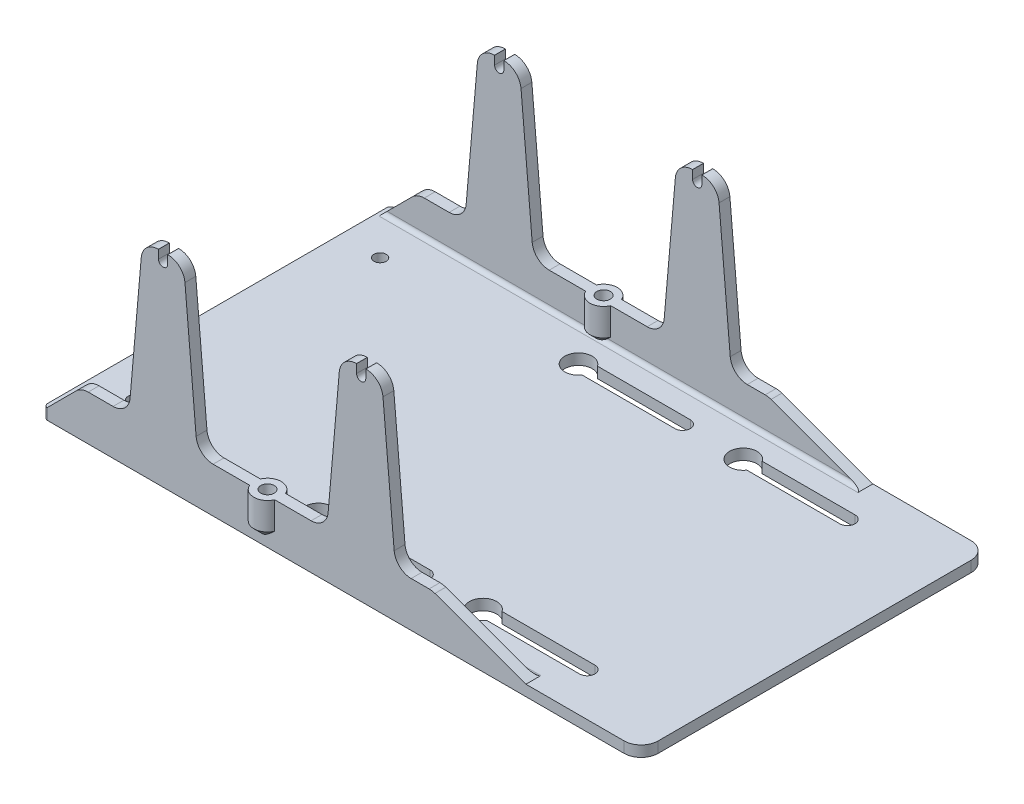
from build123d import *

# Parameters (mm, degrees)
SKETCH1_W                     = 175
SKETCH1_H                     = 101.6
PLATE_DEPTH                   = 3.175
BOTTOM_LABEL_DEPTH            = 0.6
MOUNT_SLOTS_DEPTH             = 3.175
SKETCH12_R                    = 4
SLOT_CLEARANCE_DEPTH          = 183.251805672
BRACKET_HOLES_D               = 3.6
PLATE_STIFFENER_DEPTH         = 3.175
RACK_EARS_DEPTH               = 3.175
LPATTERN1_COUNT               = 2
LPATTERN1_PITCH               = 58
STIFFENER_MIRROR_COPY_1_DEPTH = 3.175
FILLET3_R                     = 5
FILLET_1_2MM_R                = 1.2
FILLET2_R                     = 5


# Read off the part's stored shape, not the designer's step: mount slots
with BuildPart() as part:
    # Sketch1 → plate (new body)
    with BuildSketch(Plane(origin=(0, 0, 0), x_dir=(1, 0, 0), z_dir=(0, 1, 0))):
        with Locations((87.5, 0)):
            Rectangle(SKETCH1_W, SKETCH1_H)
    extrude(amount=PLATE_DEPTH)

    # Sketch14 → bottom label (cut)
    # profile 1 of 6: a face of its own
    with BuildSketch(Plane.XZ):
        with BuildLine():
            Line((77.403846154, 3.5), (78.086738782, 3.5))
            add(Edge.make_bspline(
                [(78.086738782, 3.5), (78.12016726, 3.49982425), (78.184959971, 3.499483602), (78.279179412, 3.49420047), (78.367428223, 3.486996801), (78.449731995, 3.475566708), (78.526052698, 3.461774931), (78.596620335, 3.445073115), (78.661210507, 3.425046501), (78.738323244, 3.39320022), (78.826243905, 3.345877051), (78.921442297, 3.275948486), (79.002846537, 3.190416023), (79.073032854, 3.093933368), (79.128833973, 2.987797596), (79.169203271, 2.874538407), (79.194761146, 2.755616665), (79.19738958, 2.673973487), (79.198717949, 2.63271234)],
                knots=[0, 0, 0, 0, 1.001505555, 1.941167018, 2.826882275, 3.653841531, 4.429895133, 5.150066043, 5.825578002, 6.45369114, 7.647487171, 8.808567382, 9.977351308, 11.170798116, 12.373658725, 13.556498008, 14.765093433, 16, 16, 16, 16], degree=3))
            add(Edge.make_bspline(
                [(79.198717949, 2.63271234), (79.19762473, 2.594059784), (79.195476453, 2.518103867), (79.174933694, 2.407009758), (79.142773025, 2.301258539), (79.098067776, 2.201236154), (79.03996578, 2.10920254), (78.971107461, 2.024415274), (78.888030659, 1.950464217), (78.825787419, 1.909121315), (78.794170673, 1.888120994)],
                knots=[0, 0, 0, 0, 1.044552857, 2.05264487, 3.044412934, 4.028983338, 5.005914585, 5.980388656, 6.974128949, 8, 8, 8, 8], degree=3))
            add(Edge.make_bspline(
                [(78.794170673, 1.888120994), (78.833931101, 1.872855995), (78.910002648, 1.84365027), (79.01468866, 1.792014806), (79.104883505, 1.735852696), (79.181280651, 1.674520846), (79.246618306, 1.608412035), (79.303671248, 1.536556921), (79.352352622, 1.458018163), (79.394065546, 1.373614627), (79.426614302, 1.284208159), (79.450990206, 1.190637383), (79.464957655, 1.093237828), (79.466945296, 1.026952448), (79.467948718, 0.993489583)],
                knots=[0, 0, 0, 0, 1.27268992, 2.434971085, 3.483601985, 4.442670788, 5.356604649, 6.2567628, 7.179492994, 8.113709626, 9.066344395, 10.018646069, 10.999752585, 12, 12, 12, 12], degree=3))
            add(Edge.make_bspline(
                [(79.467948718, 0.993489583), (79.466971872, 0.959322711), (79.4650499, 0.892098433), (79.450869928, 0.793343299), (79.426860821, 0.698968352), (79.393789675, 0.608363169), (79.35062736, 0.521703035), (79.298099396, 0.438889771), (79.235467832, 0.36075544), (79.165404963, 0.286431817), (79.086142818, 0.21960403), (79.000627063, 0.160088323), (78.907780743, 0.111142261), (78.809128749, 0.070026239), (78.703564433, 0.038619041), (78.591561826, 0.016646467), (78.473217524, 0.00184143), (78.392007773, 0.000624225), (78.350360577, 0)],
                knots=[0, 0, 0, 0, 0.978564426, 1.925352924, 2.850884081, 3.763762016, 4.682927383, 5.618979971, 6.567305752, 7.547517671, 8.540179244, 9.531824382, 10.526200242, 11.540722885, 12.589160233, 13.674978461, 14.80764778, 16, 16, 16, 16], degree=3))
            Line((78.350360577, 0), (77.403846154, 0))
            Line((77.403846154, 0), (77.403846154, 3.5))
        make_face()
        with BuildLine():
            Line((77.717948718, 3.141025641), (77.717948718, 2.019230769))
            Line((77.717948718, 2.019230769), (77.928986378, 2.019230769))
            add(Edge.make_bspline(
                [(77.928986378, 2.019230769), (77.959835174, 2.019630692), (78.019441333, 2.020403425), (78.105761229, 2.022616942), (78.185886248, 2.028814985), (78.259678081, 2.035011248), (78.327020525, 2.045085835), (78.387764386, 2.057077958), (78.442862983, 2.069760863), (78.506402529, 2.09133035), (78.578475477, 2.123208025), (78.655308581, 2.172679861), (78.723043051, 2.231604215), (78.780240239, 2.299595176), (78.827051709, 2.374461362), (78.859565424, 2.455008243), (78.881612708, 2.539228375), (78.88360424, 2.597046627), (78.884615385, 2.626402244)],
                knots=[0, 0, 0, 0, 1.156816544, 2.235205308, 3.236616184, 4.169592532, 5.011045266, 5.787822928, 6.49130361, 7.128639758, 8.301311294, 9.436451833, 10.541879658, 11.654887649, 12.756523258, 13.837046038, 14.901820046, 16, 16, 16, 16], degree=3))
            add(Edge.make_bspline(
                [(78.884615385, 2.626402244), (78.884089204, 2.645828015), (78.883057045, 2.683933787), (78.874603742, 2.739483141), (78.860236168, 2.791726894), (78.841781874, 2.841381004), (78.815993186, 2.886892854), (78.785629722, 2.92983605), (78.748944032, 2.968748169), (78.707186719, 3.005117667), (78.659178096, 3.037362195), (78.604946805, 3.065602958), (78.543759128, 3.088343735), (78.476646273, 3.108259887), (78.402575185, 3.122248181), (78.322400632, 3.133901569), (78.235465913, 3.139834311), (78.17532081, 3.140619673), (78.144230769, 3.141025641)],
                knots=[0, 0, 0, 0, 0.91205012, 1.789085906, 2.630437955, 3.453916878, 4.269457761, 5.079663411, 5.91843418, 6.774407191, 7.675494373, 8.627863946, 9.638891023, 10.736472738, 11.911756761, 13.175263542, 14.539845004, 16, 16, 16, 16], degree=3))
            Line((78.144230769, 3.141025641), (77.717948718, 3.141025641))
        make_face(mode=Mode.SUBTRACT)
        with BuildLine():
            Line((77.717948718, 1.66025641), (77.717948718, 0.358974359))
            Line((77.717948718, 0.358974359), (78.165264423, 0.358974359))
            add(Edge.make_bspline(
                [(78.165264423, 0.358974359), (78.197283349, 0.359358106), (78.258995608, 0.360097729), (78.348096838, 0.362512283), (78.430679941, 0.368004559), (78.506368077, 0.376650409), (78.57597853, 0.386028858), (78.638676233, 0.398640139), (78.694969426, 0.413089099), (78.760243734, 0.435423272), (78.833747242, 0.470119743), (78.912958099, 0.522433969), (78.983384317, 0.584757277), (79.043189576, 0.656888191), (79.092202565, 0.735319518), (79.12785802, 0.818464868), (79.149848876, 0.904950395), (79.152511046, 0.963917108), (79.153846154, 0.993489583)],
                knots=[0, 0, 0, 0, 1.160039823, 2.235823828, 3.228722157, 4.157150951, 4.99529583, 5.772374946, 6.472645482, 7.099169577, 8.269452708, 9.405989375, 10.527446681, 11.663510218, 12.788923519, 13.866172445, 14.929861265, 16, 16, 16, 16], degree=3))
            add(Edge.make_bspline(
                [(79.153846154, 0.993489583), (79.15357005, 1.011982924), (79.153022294, 1.048671306), (79.144761679, 1.102587125), (79.13274781, 1.154812998), (79.117216376, 1.205490739), (79.094596909, 1.253704115), (79.068190364, 1.300406674), (79.037228962, 1.345660154), (78.988984796, 1.402872407), (78.918812812, 1.46878942), (78.819106036, 1.533326923), (78.705733738, 1.58537473), (78.623506245, 1.607474206), (78.581029647, 1.618890224)],
                knots=[0, 0, 0, 0, 0.723448775, 1.435228256, 2.130040452, 2.821711965, 3.505591119, 4.210454504, 4.921174351, 5.648778258, 7.137944449, 8.670945889, 10.280296675, 12, 12, 12, 12], degree=3))
            add(Edge.make_bspline(
                [(78.581029647, 1.618890224), (78.564000552, 1.622345308), (78.527077959, 1.629836643), (78.466870379, 1.637744346), (78.39813451, 1.644789406), (78.320711633, 1.650000564), (78.234503792, 1.655387107), (78.139326873, 1.657481929), (78.035569558, 1.659981189), (77.963577186, 1.660162323), (77.926181891, 1.66025641)],
                knots=[0, 0, 0, 0, 0.634451884, 1.375622551, 2.216452059, 3.157844607, 4.20941857, 5.370758133, 6.634282058, 8, 8, 8, 8], degree=3))
            Line((77.926181891, 1.66025641), (77.717948718, 1.66025641))
        make_face(mode=Mode.SUBTRACT)
    # profile 2 of 6: a face of its own
    with BuildSketch(Plane.XZ):
        with BuildLine():
            add(Edge.make_bspline(
                [(82.119871795, 3.58974359), (82.184679901, 3.58810211), (82.311968368, 3.584878109), (82.499043265, 3.560199006), (82.677638361, 3.517503616), (82.8492085, 3.460640633), (83.011701476, 3.384786248), (83.166340369, 3.2931011), (83.312757242, 3.184624641), (83.448978624, 3.060195414), (83.573635574, 2.92481196), (83.683461461, 2.78033405), (83.775503754, 2.627635248), (83.851089541, 2.467174417), (83.910388151, 2.299314449), (83.951307195, 2.123160446), (83.977445345, 1.939853756), (83.980501122, 1.814826892), (83.982051282, 1.751402244)],
                knots=[0, 0, 0, 0, 1.065120563, 2.091984664, 3.0946048, 4.079830382, 5.057816894, 6.036188127, 7.030412546, 8.04752943, 9.064399622, 10.05169764, 11.02544977, 11.989514704, 12.962713494, 13.945757189, 14.957906945, 16, 16, 16, 16], degree=3))
            add(Edge.make_bspline(
                [(83.982051282, 1.751402244), (83.98050135, 1.688444797), (83.977446253, 1.564348377), (83.951277475, 1.382204933), (83.910236475, 1.207114236), (83.851640209, 1.039368583), (83.776414731, 0.87879102), (83.68375956, 0.725804066), (83.574618349, 0.580357567), (83.450411498, 0.444044902), (83.315010456, 0.319047431), (83.169780189, 0.210128556), (83.017986869, 0.116404431), (82.857677161, 0.041620757), (82.690977124, -0.018151163), (82.516394801, -0.058903793), (82.334748247, -0.085190837), (82.210877243, -0.088209353), (82.147916667, -0.08974359)],
                knots=[0, 0, 0, 0, 1.043624062, 2.057103931, 3.04512605, 4.022047818, 4.998200453, 5.980619268, 6.982898556, 8.009068085, 9.034988726, 10.034168286, 11.015286542, 11.987931943, 12.962482838, 13.94673481, 14.956375938, 16, 16, 16, 16], degree=3))
            add(Edge.make_bspline(
                [(82.147916667, -0.08974359), (82.084492348, -0.088194203), (81.959466132, -0.085139949), (81.775929096, -0.058958544), (81.599651353, -0.01801724), (81.431137001, 0.040492196), (81.270292072, 0.116109427), (81.116801989, 0.208313806), (80.971282842, 0.317720947), (80.834941095, 0.441887521), (80.710191897, 0.577059073), (80.601432521, 0.721893329), (80.509207408, 0.873548785), (80.433844076, 1.032446309), (80.374179616, 1.197817752), (80.333474798, 1.370766229), (80.307138846, 1.550305735), (80.304104, 1.672548634), (80.302564103, 1.734575321)],
                knots=[0, 0, 0, 0, 1.053102029, 2.075944431, 3.073151272, 4.055350789, 5.033113405, 6.020478099, 7.024410459, 8.052272461, 9.079885166, 10.07527673, 11.055994387, 12.023226415, 12.992069828, 13.970394897, 14.97016774, 16, 16, 16, 16], degree=3))
            add(Edge.make_bspline(
                [(80.302564103, 1.734575321), (80.303098738, 1.77620799), (80.304161264, 1.858948113), (80.316952957, 1.981814713), (80.335514658, 2.102705371), (80.362116571, 2.221276319), (80.396908238, 2.337237304), (80.437960265, 2.451388067), (80.48810011, 2.56257179), (80.544780758, 2.671315182), (80.608042566, 2.775923088), (80.677918316, 2.874802671), (80.751953684, 2.968783668), (80.833117078, 3.055430672), (80.918733523, 3.137264328), (81.010191901, 3.213027045), (81.106934146, 3.283401996), (81.209376525, 3.346822337), (81.3149948, 3.404181472), (81.423871578, 3.453403323), (81.53452815, 3.495649384), (81.647482798, 3.529890209), (81.76243557, 3.556922245), (81.879637354, 3.575329599), (81.99899478, 3.588153917), (82.079406099, 3.589211419), (82.119871795, 3.58974359)],
                knots=[0, 0, 0, 0, 1.037015668, 2.060948919, 3.074880161, 4.083647147, 5.086022904, 6.090072063, 7.104153813, 8.122640571, 9.144368836, 10.147691507, 11.138137339, 12.123020368, 13.103399296, 14.087645067, 15.080126199, 16.082011238, 17.087798457, 18.072939717, 19.057185487, 20.037253025, 21.01195951, 21.997135196, 22.992090687, 24, 24, 24, 24], degree=3))
        make_face()
        with BuildLine():
            add(Edge.make_bspline(
                [(82.135296474, 3.230769231), (82.102081841, 3.230364341), (82.035970108, 3.229558431), (81.937685572, 3.218942715), (81.840693638, 3.203812826), (81.744974276, 3.182231305), (81.650927986, 3.152827253), (81.557678145, 3.118986345), (81.466075091, 3.077765254), (81.376421233, 3.03119255), (81.289506158, 2.979643629), (81.207493457, 2.922671862), (81.130170813, 2.861613307), (81.057727546, 2.79632547), (80.990376374, 2.726475868), (80.926791673, 2.653123432), (80.869522091, 2.574171541), (80.817036514, 2.491761134), (80.770068674, 2.405999553), (80.728303319, 2.317789691), (80.69413931, 2.226412004), (80.666276934, 2.132857846), (80.643177123, 2.037275387), (80.628543199, 1.938939538), (80.61781084, 1.838344426), (80.617050994, 1.770362572), (80.616666667, 1.735977564)],
                knots=[0, 0, 0, 0, 1.008559885, 2.007477868, 2.99961109, 3.989939068, 4.984837346, 5.991145699, 7.001802488, 8.033829008, 9.059044045, 10.069351652, 11.065060232, 12.050310815, 13.029377138, 14.011219647, 14.996725999, 15.989392538, 16.977580475, 17.965360261, 18.951710183, 19.937753436, 20.929683414, 21.935841486, 22.955955122, 24, 24, 24, 24], degree=3))
            add(Edge.make_bspline(
                [(80.616666667, 1.735977564), (80.617941529, 1.685415343), (80.620449576, 1.585943813), (80.642407147, 1.440175669), (80.676229121, 1.300087383), (80.726086487, 1.166445474), (80.788437102, 1.038101191), (80.865463992, 0.916193086), (80.956723078, 0.800688212), (81.060386605, 0.692392943), (81.173709311, 0.593547138), (81.294042041, 0.50678373), (81.420095649, 0.43337348), (81.552198851, 0.373568408), (81.68964639, 0.32617867), (81.833323941, 0.293700039), (81.982274401, 0.272324583), (82.083805056, 0.270271827), (82.135296474, 0.269230769)],
                knots=[0, 0, 0, 0, 1.032063989, 2.030389145, 3.003944642, 3.970395727, 4.937377036, 5.913328081, 6.909231446, 7.93887556, 8.970685674, 9.976071282, 10.964166581, 11.944589148, 12.933237628, 13.927779006, 14.949070134, 16, 16, 16, 16], degree=3))
            add(Edge.make_bspline(
                [(82.135296474, 0.269230769), (82.169905976, 0.269706274), (82.238547012, 0.270649342), (82.340642535, 0.280148018), (82.440898746, 0.295379888), (82.539175026, 0.317310543), (82.635359838, 0.34475775), (82.729854641, 0.377365478), (82.821652931, 0.418046682), (82.911912769, 0.462994633), (82.998309011, 0.514234791), (83.080784543, 0.56927294), (83.157260523, 0.630241561), (83.229649594, 0.694559374), (83.297277283, 0.763523221), (83.359686267, 0.837043443), (83.4166664, 0.9155841), (83.469132046, 0.997869506), (83.515935309, 1.083865759), (83.556714408, 1.172395437), (83.591310524, 1.263240546), (83.619239029, 1.356532118), (83.64112449, 1.452092966), (83.65620441, 1.550051045), (83.666752849, 1.650210387), (83.667547926, 1.717954243), (83.667948718, 1.752103365)],
                knots=[0, 0, 0, 0, 1.047197238, 2.076906641, 3.100256066, 4.114471768, 5.12198147, 6.126382909, 7.136867548, 8.15857795, 9.17633901, 10.174870724, 11.156907918, 12.133735059, 13.104061851, 14.077631395, 15.04955518, 16.038496417, 17.029181396, 18.010275684, 18.986308667, 19.968651475, 20.955262928, 21.950658345, 22.966943676, 24, 24, 24, 24], degree=3))
            add(Edge.make_bspline(
                [(83.667948718, 1.752103365), (83.667547605, 1.78601887), (83.666751923, 1.85329652), (83.656209449, 1.952757338), (83.641108558, 2.05001055), (83.61934585, 2.144674353), (83.591295697, 2.236772878), (83.556708366, 2.326219625), (83.515923067, 2.413347821), (83.469114842, 2.497942118), (83.416499019, 2.579116855), (83.359004776, 2.656719268), (83.295639428, 2.729292009), (83.228213403, 2.798626703), (83.155042517, 2.863244593), (83.076458223, 2.923167114), (82.993414546, 2.979840388), (82.90548731, 3.03096595), (82.814743356, 3.078180182), (82.721629398, 3.118631186), (82.627200299, 3.153003305), (82.531696186, 3.18232027), (82.434313208, 3.2037283), (82.335709379, 3.21895635), (82.236021121, 3.229554736), (82.168977901, 3.230363114), (82.135296474, 3.230769231)],
                knots=[0, 0, 0, 0, 1.02996197, 2.043119294, 3.035359645, 4.018872909, 4.991431989, 5.957985074, 6.929999688, 7.912076566, 8.892894881, 9.867085534, 10.843653904, 11.817741046, 12.803660682, 13.806313499, 14.818574707, 15.856120519, 16.894564902, 17.924820532, 18.937903209, 19.946497019, 20.957711757, 21.963978472, 22.977135795, 24, 24, 24, 24], degree=3))
        make_face(mode=Mode.SUBTRACT)
    # profile 3 of 6: a face of its own
    with BuildSketch(Plane.XZ):
        Polygon((84.592307692, 3.141025641), (84.592307692, 3.5), (86.432051282, 3.5), (86.432051282, 3.141025641), (85.669230769, 3.141025641), (85.669230769, 0), (85.355128205, 0), (85.355128205, 3.141025641), align=None)
    # profile 4 of 6: a face of its own
    with BuildSketch(Plane.XZ):
        Polygon((86.862820513, 3.141025641), (86.862820513, 3.5), (88.702564103, 3.5), (88.702564103, 3.141025641), (87.93974359, 3.141025641), (87.93974359, 0), (87.625641026, 0), (87.625641026, 3.141025641), align=None)
    # profile 5 of 6: a face of its own
    with BuildSketch(Plane.XZ):
        with BuildLine():
            add(Edge.make_bspline(
                [(91.175, 3.58974359), (91.239808106, 3.58810211), (91.367096573, 3.584878109), (91.554171471, 3.560199006), (91.732766566, 3.517503616), (91.904336705, 3.460640633), (92.066829681, 3.384786248), (92.221468574, 3.2931011), (92.367885448, 3.184624641), (92.504106829, 3.060195414), (92.628763779, 2.92481196), (92.738589666, 2.78033405), (92.830631959, 2.627635248), (92.906217747, 2.467174417), (92.965516356, 2.299314449), (93.0064354, 2.123160446), (93.03257355, 1.939853756), (93.035629327, 1.814826892), (93.037179487, 1.751402244)],
                knots=[0, 0, 0, 0, 1.065120563, 2.091984664, 3.0946048, 4.079830382, 5.057816894, 6.036188127, 7.030412546, 8.04752943, 9.064399622, 10.05169764, 11.02544977, 11.989514704, 12.962713494, 13.945757189, 14.957906945, 16, 16, 16, 16], degree=3))
            add(Edge.make_bspline(
                [(93.037179487, 1.751402244), (93.035629555, 1.688444797), (93.032574458, 1.564348377), (93.006405681, 1.382204933), (92.965364681, 1.207114236), (92.906768414, 1.039368583), (92.831542936, 0.87879102), (92.738887765, 0.725804066), (92.629746554, 0.580357567), (92.505539703, 0.444044902), (92.370138661, 0.319047431), (92.224908394, 0.210128556), (92.073115074, 0.116404431), (91.912805366, 0.041620757), (91.746105329, -0.018151163), (91.571523006, -0.058903793), (91.389876452, -0.085190837), (91.266005448, -0.088209353), (91.203044872, -0.08974359)],
                knots=[0, 0, 0, 0, 1.043624062, 2.057103931, 3.04512605, 4.022047818, 4.998200453, 5.980619268, 6.982898556, 8.009068085, 9.034988726, 10.034168286, 11.015286542, 11.987931943, 12.962482838, 13.94673481, 14.956375938, 16, 16, 16, 16], degree=3))
            add(Edge.make_bspline(
                [(91.203044872, -0.08974359), (91.139620553, -0.088194203), (91.014594337, -0.085139949), (90.831057301, -0.058958544), (90.654779558, -0.01801724), (90.486265206, 0.040492196), (90.325420277, 0.116109427), (90.171930194, 0.208313806), (90.026411047, 0.317720947), (89.8900693, 0.441887521), (89.765320102, 0.577059073), (89.656560727, 0.721893329), (89.564335613, 0.873548785), (89.488972281, 1.032446309), (89.429307821, 1.197817752), (89.388603003, 1.370766229), (89.362267051, 1.550305735), (89.359232205, 1.672548634), (89.357692308, 1.734575321)],
                knots=[0, 0, 0, 0, 1.053102029, 2.075944431, 3.073151272, 4.055350789, 5.033113405, 6.020478099, 7.024410459, 8.052272461, 9.079885166, 10.07527673, 11.055994387, 12.023226415, 12.992069828, 13.970394897, 14.97016774, 16, 16, 16, 16], degree=3))
            add(Edge.make_bspline(
                [(89.357692308, 1.734575321), (89.358226943, 1.77620799), (89.35928947, 1.858948113), (89.372081162, 1.981814713), (89.390642863, 2.102705371), (89.417244776, 2.221276319), (89.452036443, 2.337237304), (89.49308847, 2.451388067), (89.543228316, 2.56257179), (89.599908964, 2.671315182), (89.663170772, 2.775923088), (89.733046521, 2.874802671), (89.807081889, 2.968783668), (89.888245283, 3.055430672), (89.973861728, 3.137264328), (90.065320106, 3.213027045), (90.162062351, 3.283401996), (90.264504731, 3.346822337), (90.370123005, 3.404181472), (90.478999783, 3.453403323), (90.589656355, 3.495649384), (90.702611003, 3.529890209), (90.817563775, 3.556922245), (90.934765559, 3.575329599), (91.054122986, 3.588153917), (91.134534305, 3.589211419), (91.175, 3.58974359)],
                knots=[0, 0, 0, 0, 1.037015668, 2.060948919, 3.074880161, 4.083647147, 5.086022904, 6.090072063, 7.104153813, 8.122640571, 9.144368836, 10.147691507, 11.138137339, 12.123020368, 13.103399296, 14.087645067, 15.080126199, 16.082011238, 17.087798457, 18.072939717, 19.057185487, 20.037253025, 21.01195951, 21.997135196, 22.992090687, 24, 24, 24, 24], degree=3))
        make_face()
        with BuildLine():
            add(Edge.make_bspline(
                [(91.190424679, 3.230769231), (91.157210046, 3.230364341), (91.091098313, 3.229558431), (90.992813777, 3.218942715), (90.895821843, 3.203812826), (90.800102481, 3.182231305), (90.706056191, 3.152827253), (90.61280635, 3.118986345), (90.521203296, 3.077765254), (90.431549438, 3.03119255), (90.344634363, 2.979643629), (90.262621662, 2.922671862), (90.185299018, 2.861613307), (90.112855751, 2.79632547), (90.045504579, 2.726475868), (89.981919878, 2.653123432), (89.924650296, 2.574171541), (89.872164719, 2.491761134), (89.825196879, 2.405999553), (89.783431524, 2.317789691), (89.749267515, 2.226412004), (89.721405139, 2.132857846), (89.698305328, 2.037275387), (89.683671404, 1.938939538), (89.672939045, 1.838344426), (89.672179199, 1.770362572), (89.671794872, 1.735977564)],
                knots=[0, 0, 0, 0, 1.008559885, 2.007477868, 2.99961109, 3.989939068, 4.984837346, 5.991145699, 7.001802488, 8.033829008, 9.059044045, 10.069351652, 11.065060232, 12.050310815, 13.029377138, 14.011219647, 14.996725999, 15.989392538, 16.977580475, 17.965360261, 18.951710183, 19.937753436, 20.929683414, 21.935841486, 22.955955122, 24, 24, 24, 24], degree=3))
            add(Edge.make_bspline(
                [(89.671794872, 1.735977564), (89.673069734, 1.685415343), (89.675577782, 1.585943813), (89.697535352, 1.440175669), (89.731357326, 1.300087383), (89.781214693, 1.166445474), (89.843565307, 1.038101191), (89.920592198, 0.916193086), (90.011851283, 0.800688212), (90.11551481, 0.692392943), (90.228837516, 0.593547138), (90.349170246, 0.50678373), (90.475223854, 0.43337348), (90.607327056, 0.373568408), (90.744774595, 0.32617867), (90.888452147, 0.293700039), (91.037402606, 0.272324583), (91.138933261, 0.270271827), (91.190424679, 0.269230769)],
                knots=[0, 0, 0, 0, 1.032063989, 2.030389145, 3.003944642, 3.970395727, 4.937377036, 5.913328081, 6.909231446, 7.93887556, 8.970685674, 9.976071282, 10.964166581, 11.944589148, 12.933237628, 13.927779006, 14.949070134, 16, 16, 16, 16], degree=3))
            add(Edge.make_bspline(
                [(91.190424679, 0.269230769), (91.225034181, 0.269706274), (91.293675217, 0.270649342), (91.39577074, 0.280148018), (91.496026952, 0.295379888), (91.594303231, 0.317310543), (91.690488043, 0.34475775), (91.784982846, 0.377365478), (91.876781136, 0.418046682), (91.967040974, 0.462994633), (92.053437216, 0.514234791), (92.135912748, 0.56927294), (92.212388728, 0.630241561), (92.284777799, 0.694559374), (92.352405488, 0.763523221), (92.414814473, 0.837043443), (92.471794605, 0.9155841), (92.524260251, 0.997869506), (92.571063514, 1.083865759), (92.611842613, 1.172395437), (92.646438729, 1.263240546), (92.674367234, 1.356532118), (92.696252695, 1.452092966), (92.711332615, 1.550051045), (92.721881054, 1.650210387), (92.722676131, 1.717954243), (92.723076923, 1.752103365)],
                knots=[0, 0, 0, 0, 1.047197238, 2.076906641, 3.100256066, 4.114471768, 5.12198147, 6.126382909, 7.136867548, 8.15857795, 9.17633901, 10.174870724, 11.156907918, 12.133735059, 13.104061851, 14.077631395, 15.04955518, 16.038496417, 17.029181396, 18.010275684, 18.986308667, 19.968651475, 20.955262928, 21.950658345, 22.966943676, 24, 24, 24, 24], degree=3))
            add(Edge.make_bspline(
                [(92.723076923, 1.752103365), (92.72267581, 1.78601887), (92.721880129, 1.85329652), (92.711337654, 1.952757338), (92.696236764, 2.05001055), (92.674474056, 2.144674353), (92.646423902, 2.236772878), (92.611836571, 2.326219625), (92.571051272, 2.413347821), (92.524243048, 2.497942118), (92.471627224, 2.579116855), (92.414132981, 2.656719268), (92.350767633, 2.729292009), (92.283341608, 2.798626703), (92.210170722, 2.863244593), (92.131586428, 2.923167114), (92.048542751, 2.979840388), (91.960615515, 3.03096595), (91.869871561, 3.078180182), (91.776757603, 3.118631186), (91.682328504, 3.153003305), (91.586824392, 3.18232027), (91.489441413, 3.2037283), (91.390837584, 3.21895635), (91.291149326, 3.229554736), (91.224106106, 3.230363114), (91.190424679, 3.230769231)],
                knots=[0, 0, 0, 0, 1.02996197, 2.043119294, 3.035359645, 4.018872909, 4.991431989, 5.957985074, 6.929999688, 7.912076566, 8.892894881, 9.867085534, 10.843653904, 11.817741046, 12.803660682, 13.806313499, 14.818574707, 15.856120519, 16.894564902, 17.924820532, 18.937903209, 19.946497019, 20.957711757, 21.963978472, 22.977135795, 24, 24, 24, 24], degree=3))
        make_face(mode=Mode.SUBTRACT)
    # profile 6 of 6: a face of its own
    with BuildSketch(Plane.XZ):
        Polygon((93.871794872, 0), (94.333834135, 3.5), (94.378705929, 3.5), (95.823717949, 0.628205128), (97.265224359, 3.5), (97.310797276, 3.5), (97.775641026, 0), (97.460136218, 0), (97.125, 2.518429487), (95.861578526, 0), (95.790765224, 0), (94.522435897, 2.524038462), (94.188000801, 0), align=None)
    extrude(amount=-BOTTOM_LABEL_DEPTH, mode=Mode.SUBTRACT)

    # mount slots outline → mount slots (cut)
    with BuildSketch(Plane(origin=(0, 0, 0), x_dir=(1, 0, 0), z_dir=(0, 1, 0))):
        with BuildLine():
            Line((67.75, -40.35), (98.25, -40.35))
            ThreePointArc((98.25, -40.35), (100.5, -38.1), (98.25, -35.85))
            Line((98.25, -35.85), (67.75, -35.85))
            ThreePointArc((67.75, -35.85), (65.5, -38.1), (67.75, -40.35))
        make_face()
        with BuildLine():
            ThreePointArc((146.51, -40.35), (148.76, -38.1), (146.51, -35.85))
            Line((146.51, -35.85), (116.01, -35.85))
            ThreePointArc((116.01, -35.85), (113.76, -38.1), (116.01, -40.35))
            Line((116.01, -40.35), (146.51, -40.35))
        make_face()
        with BuildLine():
            Line((116.01, 35.85), (146.51, 35.85))
            ThreePointArc((146.51, 35.85), (148.76, 38.1), (146.51, 40.35))
            Line((146.51, 40.35), (116.01, 40.35))
            ThreePointArc((116.01, 40.35), (113.76, 38.1), (116.01, 35.85))
        make_face()
        with BuildLine():
            ThreePointArc((98.25, 35.85), (100.5, 38.1), (98.25, 40.35))
            Line((98.25, 40.35), (67.75, 40.35))
            ThreePointArc((67.75, 40.35), (65.5, 38.1), (67.75, 35.85))
            Line((67.75, 35.85), (98.25, 35.85))
        make_face()
    extrude(amount=MOUNT_SLOTS_DEPTH, mode=Mode.SUBTRACT)

    # Sketch12 → slot_clearance (cut, through all)
    with BuildSketch(Plane(origin=(0, 3.175, 0), x_dir=(1, 0, 0), z_dir=(0, 1, 0))):
        with Locations((116.01, 38.1)):
            Circle(SKETCH12_R)
        with Locations((67.75, 38.1)):
            Circle(SKETCH12_R)
        with Locations((67.75, -38.1)):
            Circle(SKETCH12_R)
        with Locations((116.01, -38.1)):
            Circle(SKETCH12_R)
    extrude(amount=-SLOT_CLEARANCE_DEPTH, mode=Mode.SUBTRACT)

    # bracket holes (through all)
    with Locations(Plane(origin=(0, 3.175, 0), x_dir=(1, 0, 0), z_dir=(0, 1, 0))):
        with Locations((11.75, 36), (11.75, -36)):
            Hole(BRACKET_HOLES_D / 2)

    # Sketch13 → plate stiffener (add)
    with BuildSketch(Plane(origin=(0, 0, -50.8), x_dir=(-1, 0, 0), z_dir=(0, 0, -1))):
        Polygon((-141.26, 3.175), (-113.785225805, 13.175), (-11, 13.175), (-1, 3.175), align=None)
    plate_stiffener = extrude(amount=-PLATE_STIFFENER_DEPTH)

    # Sketch15 → rack ears (add)
    with BuildSketch(Plane(origin=(0, 0, -50.8), x_dir=(-1, 0, 0), z_dir=(0, 0, -1))):
        with BuildLine():
            Line((-45.068222854, 13.175), (-41, 59.675))
            Line((-41, 59.675), (-36.35, 59.675))
            Line((-36.35, 59.675), (-36.35, 57.175))
            ThreePointArc((-36.35, 57.175), (-35, 55.825), (-33.65, 57.175))
            Line((-33.65, 57.175), (-33.65, 59.675))
            Line((-33.65, 59.675), (-29, 59.675))
            Line((-29, 59.675), (-24.931777146, 13.175))
            Line((-24.931777146, 13.175), (-45.068222854, 13.175))
        make_face()
    rack_ears = extrude(amount=-RACK_EARS_DEPTH)

    # LPattern1: rack ears ×2
    with Locations(*[(i * LPATTERN1_PITCH, 0, 0) for i in range(1, LPATTERN1_COUNT)]):
        add(rack_ears)

    # Sketch21 → clamp boss (revolve)
    with BuildSketch(Plane(origin=(0, 0, -49.2125), x_dir=(-1, 0, 0), z_dir=(0, 0, -1))):
        Polygon((-64, 1.175), (-60, 5.175), (-60, 13.175), (-64, 13.175), align=None)
    clamp_boss = revolve(axis=Axis((64, 3.175, -49.2125), (0, 1, 0)))

    # Sketch19 → Tap Drill for M2.5 Tap1 (revolve, cut)
    with BuildSketch(Plane(origin=(64, 13.175, -49.2125), x_dir=(0, 0, 1), z_dir=(1, 0, 0))):
        Polygon((0, 0), (0, 9.063523296), (1.77, 8), (1.77, 2.860133251), (1.97, 0), align=None)
    tap_drill_for_m2_5_tap1 = revolve(axis=Axis((64, 19.525, -49.2125), (0, -1, 0)), mode=Mode.SUBTRACT)

    # stiffener mirror: plate stiffener, rack ears, clamp boss, Tap Drill for M2.5 Tap1 across plane
    add(plate_stiffener.mirror(Plane.XY))
    add(rack_ears.mirror(Plane.XY))
    add(clamp_boss.mirror(Plane.XY))
    add(tap_drill_for_m2_5_tap1.mirror(Plane.XY), mode=Mode.SUBTRACT)

    # stiffener mirror copy 1 sketch → stiffener mirror copy 1 (add)
    with BuildSketch(Plane(origin=(58, 0, 50.8), x_dir=(-1, 0, 0), z_dir=(0, 0, 1))):
        with BuildLine():
            Line((-45.068222854, -13.175), (-41, -59.675))
            Line((-41, -59.675), (-36.35, -59.675))
            Line((-36.35, -59.675), (-36.35, -57.175))
            ThreePointArc((-36.35, -57.175), (-35, -55.825), (-33.65, -57.175))
            Line((-33.65, -57.175), (-33.65, -59.675))
            Line((-33.65, -59.675), (-29, -59.675))
            Line((-29, -59.675), (-24.931777146, -13.175))
            Line((-24.931777146, -13.175), (-45.068222854, -13.175))
        make_face()
    extrude(amount=-STIFFENER_MIRROR_COPY_1_DEPTH)

    # Fillet3
    fillet3_edges = [part.edges().sort_by_distance(p)[0] for p in [
        (113.785225805, 13.175, -49.2125),
        (11, 13.175, -49.2125),
        (24.931777146, 13.175, -49.2125),
        (45.068222854, 13.175, -49.2125),
        (41, 59.675, -49.2125),
        (29, 59.675, -49.2125),
        (82.931777146, 13.175, -49.2125),
        (103.068222854, 13.175, -49.2125),
        (99, 59.675, -49.2125),
        (87, 59.675, -49.2125),
        (11, 13.175, 49.2125),
        (113.785225805, 13.175, 49.2125),
        (45.068222854, 13.175, 49.2125),
        (24.931777146, 13.175, 49.2125),
        (29, 59.675, 49.2125),
        (41, 59.675, 49.2125),
        (103.068222854, 13.175, 49.2125),
        (82.931777146, 13.175, 49.2125),
        (87, 59.675, 49.2125),
        (99, 59.675, 49.2125),
    ]]
    fillet(fillet3_edges, radius=FILLET3_R)

    # Fillet 1.2mm
    # the kernel refuses this fillet: 1.2 mm, written as the material it adds along each edge
    with BuildSketch(Plane(origin=(62.216488286, 3.175, -47.625), x_dir=(0, 0, 1), z_dir=(1, 0, 0))) as fillet_1_2mm_piece_1_section:
        with BuildLine():
            CenterArc((FILLET_1_2MM_R, -FILLET_1_2MM_R), FILLET_1_2MM_R, 90, 90)
            Line((0, -FILLET_1_2MM_R), (0, 0))
            Line((0, 0), (FILLET_1_2MM_R, 0))
        make_face()
    fillet_1_2mm_piece_1 = extrude(amount=82.043511714, mode=Mode.PRIVATE)
    fillet_1_2mm_piece_1 = split(fillet_1_2mm_piece_1, bisect_by=Plane(origin=(106.934568572, 15.668435318, -47.347732614), z_dir=(-0.3420201433256633, -0.9396926207859104, 0)), keep=Keep.TOP, mode=Mode.PRIVATE)
    add(fillet_1_2mm_piece_1)
    with BuildSketch(Plane(origin=(-2, 3.175, -47.625), x_dir=(0, 0, 1), z_dir=(1, 0, 0))) as fillet_1_2mm_piece_2_section:
        with BuildLine():
            CenterArc((FILLET_1_2MM_R, -FILLET_1_2MM_R), FILLET_1_2MM_R, 90, 90)
            Line((0, -FILLET_1_2MM_R), (0, 0))
            Line((0, 0), (FILLET_1_2MM_R, 0))
        make_face()
    fillet_1_2mm_piece_2 = extrude(amount=67.783511714, mode=Mode.PRIVATE)
    fillet_1_2mm_piece_2 = split(fillet_1_2mm_piece_2, bisect_by=Plane(origin=(16.841062133, 19.016062133, -47.347603832), z_dir=(0.7071067811865436, -0.7071067811865516, 0)), keep=Keep.TOP, mode=Mode.PRIVATE)
    add(fillet_1_2mm_piece_2)
    with BuildSketch(Plane(origin=(62.216488286, 3.175, 47.625), x_dir=(0, 0, -1), z_dir=(1, 0, 0))) as fillet_1_2mm_piece_3_section:
        with BuildLine():
            CenterArc((FILLET_1_2MM_R, FILLET_1_2MM_R), FILLET_1_2MM_R, 180, 90)
            Line((0, FILLET_1_2MM_R), (0, 0))
            Line((0, 0), (FILLET_1_2MM_R, 0))
        make_face()
    fillet_1_2mm_piece_3 = extrude(amount=82.043511714, mode=Mode.PRIVATE)
    fillet_1_2mm_piece_3 = split(fillet_1_2mm_piece_3, bisect_by=Plane(origin=(106.934568572, 15.668435318, 47.347732614), z_dir=(-0.3420201433256633, -0.9396926207859104, 0)), keep=Keep.TOP, mode=Mode.PRIVATE)
    add(fillet_1_2mm_piece_3)
    with BuildSketch(Plane(origin=(-2, 3.175, 47.625), x_dir=(0, 0, -1), z_dir=(1, 0, 0))) as fillet_1_2mm_piece_4_section:
        with BuildLine():
            CenterArc((FILLET_1_2MM_R, FILLET_1_2MM_R), FILLET_1_2MM_R, 180, 90)
            Line((0, FILLET_1_2MM_R), (0, 0))
            Line((0, 0), (FILLET_1_2MM_R, 0))
        make_face()
    fillet_1_2mm_piece_4 = extrude(amount=67.783511714, mode=Mode.PRIVATE)
    fillet_1_2mm_piece_4 = split(fillet_1_2mm_piece_4, bisect_by=Plane(origin=(16.841062133, 19.016062133, 47.347603832), z_dir=(0.7071067811865436, -0.7071067811865516, 0)), keep=Keep.TOP, mode=Mode.PRIVATE)
    add(fillet_1_2mm_piece_4)
    # the kernel refuses this fillet: 1.2 mm, written as the material it takes off along each edge
    with BuildSketch(Plane(origin=(0, -3, 50.8), x_dir=(0, 0, -1), z_dir=(0, 1, 0)), Plane(origin=(0, -3, -50.8), x_dir=(1, 0, 0), z_dir=(0, 1, 0))) as fillet_1_2mm_2_piece_1:
        with BuildLine():
            CenterArc((FILLET_1_2MM_R, -FILLET_1_2MM_R), FILLET_1_2MM_R, 90, 90)
            Line((0, -FILLET_1_2MM_R), (0, 0))
            Line((0, 0), (FILLET_1_2MM_R, 0))
        make_face()
    extrude(amount=9.175, mode=Mode.SUBTRACT)

    # Fillet2
    fillet2_edges = [part.edges().sort_by_distance(p)[0] for p in [
        (175, 1.5875, 50.8),
        (175, 1.5875, -50.8),
    ]]
    fillet(fillet2_edges, radius=FILLET2_R)


solid = part.part
